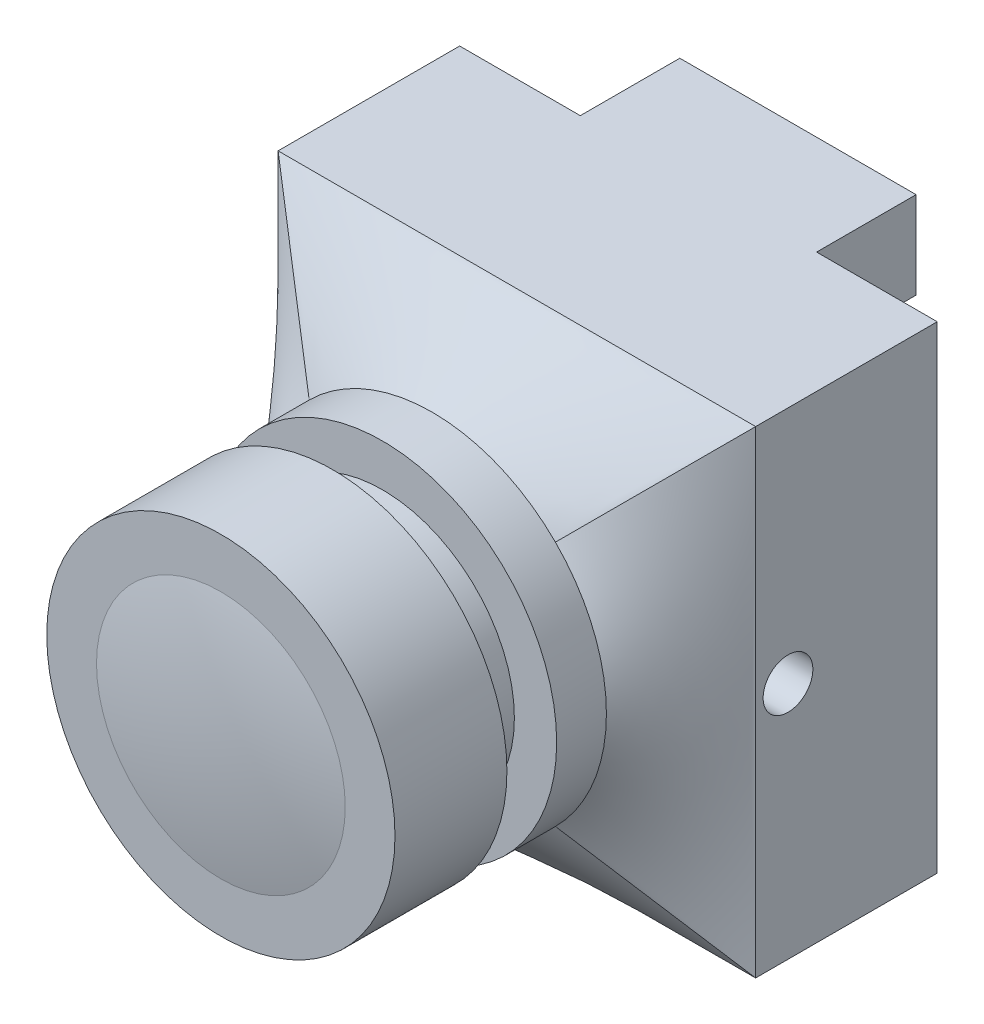
from build123d import *

# Parameters (mm, degrees)
SKETCH1_W           = 19.2
SKETCH1_H           = 19.2
BOSS_EXTRUDE1_DEPTH = 7.3
BOSS_EXTRUDE2_DEPTH = 2
SKETCH4_R           = 5.3
BOSS_EXTRUDE3_DEPTH = 2
SKETCH5_R           = 7
BOSS_EXTRUDE4_DEPTH = 4.5
SKETCH7_R           = 1
CUT_EXTRUDE1_DEPTH  = 19.2
SKETCH8_W           = 9.5
SKETCH8_H           = 3.5
BOSS_EXTRUDE5_DEPTH = 4


with BuildPart() as part:
    # Sketch1 → Boss-Extrude1 (new body)
    with BuildSketch(Plane.XY):
        Rectangle(SKETCH1_W, SKETCH1_H)
    extrude(amount=BOSS_EXTRUDE1_DEPTH)

    # Loft1: read off the stored shape, not the designer's step
    # Loft1: loft between two sections, ruled curve by curve
    loft1_from = [
        Edge.make_bspline([(9.6, -9.6, 7.3), (9.6, -8.8, 7.3), (9.6, -8, 7.3), (9.6, -6.4, 7.3), (9.6, -5.6, 7.3), (9.6, -4, 7.3), (9.6, -3.2, 7.3), (9.6, -1.6, 7.3), (9.6, -0.8, 7.3), (9.6, 0.8, 7.3), (9.6, 1.6, 7.3), (9.6, 3.2, 7.3), (9.6, 4, 7.3), (9.6, 5.6, 7.3), (9.6, 6.4, 7.3), (9.6, 8, 7.3), (9.6, 8.8, 7.3), (9.6, 9.6, 7.3)], [0, 0, 0, 0, 0.125, 0.125, 0.25, 0.25, 0.375, 0.375, 0.5, 0.5, 0.625, 0.625, 0.75, 0.75, 0.875, 0.875, 1, 1, 1, 1], 3),
        Edge.make_bspline([(9.6, 9.6, 7.3), (8.8, 9.6, 7.3), (8, 9.6, 7.3), (6.4, 9.6, 7.3), (5.6, 9.6, 7.3), (4, 9.6, 7.3), (3.2, 9.6, 7.3), (1.6, 9.6, 7.3), (0.8, 9.6, 7.3), (-0.8, 9.6, 7.3), (-1.6, 9.6, 7.3), (-3.2, 9.6, 7.3), (-4, 9.6, 7.3), (-5.6, 9.6, 7.3), (-6.4, 9.6, 7.3), (-8, 9.6, 7.3), (-8.8, 9.6, 7.3), (-9.6, 9.6, 7.3)], [0, 0, 0, 0, 0.125, 0.125, 0.25, 0.25, 0.375, 0.375, 0.5, 0.5, 0.625, 0.625, 0.75, 0.75, 0.875, 0.875, 1, 1, 1, 1], 3),
        Edge.make_bspline([(-9.6, -9.6, 7.3), (-8.8, -9.6, 7.3), (-8, -9.6, 7.3), (-6.4, -9.6, 7.3), (-5.6, -9.6, 7.3), (-4, -9.6, 7.3), (-3.2, -9.6, 7.3), (-1.6, -9.6, 7.3), (-0.8, -9.6, 7.3), (0.8, -9.6, 7.3), (1.6, -9.6, 7.3), (3.2, -9.6, 7.3), (4, -9.6, 7.3), (5.6, -9.6, 7.3), (6.4, -9.6, 7.3), (8, -9.6, 7.3), (8.8, -9.6, 7.3), (9.6, -9.6, 7.3)], [0, 0, 0, 0, 0.125, 0.125, 0.25, 0.25, 0.375, 0.375, 0.5, 0.5, 0.625, 0.625, 0.75, 0.75, 0.875, 0.875, 1, 1, 1, 1], 3),
        Edge.make_bspline([(-9.6, 9.6, 7.3), (-9.6, 8.8, 7.3), (-9.6, 8, 7.3), (-9.6, 6.4, 7.3), (-9.6, 5.6, 7.3), (-9.6, 4, 7.3), (-9.6, 3.2, 7.3), (-9.6, 1.6, 7.3), (-9.6, 0.8, 7.3), (-9.6, -0.8, 7.3), (-9.6, -1.6, 7.3), (-9.6, -3.2, 7.3), (-9.6, -4, 7.3), (-9.6, -5.6, 7.3), (-9.6, -6.4, 7.3), (-9.6, -8, 7.3), (-9.6, -8.8, 7.3), (-9.6, -9.6, 7.3)], [0, 0, 0, 0, 0.125, 0.125, 0.25, 0.25, 0.375, 0.375, 0.5, 0.5, 0.625, 0.625, 0.75, 0.75, 0.875, 0.875, 1, 1, 1, 1], 3),
    ]
    loft1_to = [
        Edge.make_bspline([(4.949747468, -4.949747468, 10.7), (5.241414135, -4.658080802, 10.7), (5.518059607, -4.329578337, 10.7), (6.017509224, -3.603305863, 10.7), (6.24015166, -3.205498765, 10.7), (6.608234632, -2.3549841, 10.7), (6.753494754, -1.902343121, 10.7), (6.949438254, -0.966389521, 10.7), (7, -0.483249156, 10.7), (7, 0.483249156, 10.7), (6.949438254, 0.966389521, 10.7), (6.753494754, 1.902343121, 10.7), (6.608234632, 2.3549841, 10.7), (6.24015166, 3.205498765, 10.7), (6.017509224, 3.603305863, 10.7), (5.518059607, 4.329578337, 10.7), (5.241414135, 4.658080802, 10.7), (4.949747468, 4.949747468, 10.7)], [0, 0, 0, 0, 0.125, 0.125, 0.25, 0.25, 0.375, 0.375, 0.5, 0.5, 0.625, 0.625, 0.75, 0.75, 0.875, 0.875, 1, 1, 1, 1], 3),
        Edge.make_bspline([(4.949747468, 4.949747468, 10.7), (4.658080802, 5.241414135, 10.7), (4.329578337, 5.518059607, 10.7), (3.603305863, 6.017509224, 10.7), (3.205498765, 6.24015166, 10.7), (2.3549841, 6.608234632, 10.7), (1.902343121, 6.753494754, 10.7), (0.966389521, 6.949438254, 10.7), (0.483249156, 7, 10.7), (-0.483249156, 7, 10.7), (-0.966389521, 6.949438254, 10.7), (-1.902343121, 6.753494754, 10.7), (-2.3549841, 6.608234632, 10.7), (-3.205498765, 6.24015166, 10.7), (-3.603305863, 6.017509224, 10.7), (-4.329578337, 5.518059607, 10.7), (-4.658080802, 5.241414135, 10.7), (-4.949747468, 4.949747468, 10.7)], [0, 0, 0, 0, 0.125, 0.125, 0.25, 0.25, 0.375, 0.375, 0.5, 0.5, 0.625, 0.625, 0.75, 0.75, 0.875, 0.875, 1, 1, 1, 1], 3),
        Edge.make_bspline([(-4.949747468, -4.949747468, 10.7), (-4.658080802, -5.241414135, 10.7), (-4.329578337, -5.518059607, 10.7), (-3.603305863, -6.017509224, 10.7), (-3.205498765, -6.24015166, 10.7), (-2.3549841, -6.608234632, 10.7), (-1.902343121, -6.753494754, 10.7), (-0.966389521, -6.949438254, 10.7), (-0.483249156, -7, 10.7), (0.483249156, -7, 10.7), (0.966389521, -6.949438254, 10.7), (1.902343121, -6.753494754, 10.7), (2.3549841, -6.608234632, 10.7), (3.205498765, -6.24015166, 10.7), (3.603305863, -6.017509224, 10.7), (4.329578337, -5.518059607, 10.7), (4.658080802, -5.241414135, 10.7), (4.949747468, -4.949747468, 10.7)], [0, 0, 0, 0, 0.125, 0.125, 0.25, 0.25, 0.375, 0.375, 0.5, 0.5, 0.625, 0.625, 0.75, 0.75, 0.875, 0.875, 1, 1, 1, 1], 3),
        Edge.make_bspline([(-4.949747468, 4.949747468, 10.7), (-5.241414135, 4.658080802, 10.7), (-5.518059607, 4.329578337, 10.7), (-6.017509224, 3.603305863, 10.7), (-6.24015166, 3.205498765, 10.7), (-6.608234632, 2.3549841, 10.7), (-6.753494754, 1.902343121, 10.7), (-6.949438254, 0.966389521, 10.7), (-7, 0.483249156, 10.7), (-7, -0.483249156, 10.7), (-6.949438254, -0.966389521, 10.7), (-6.753494754, -1.902343121, 10.7), (-6.608234632, -2.3549841, 10.7), (-6.24015166, -3.205498765, 10.7), (-6.017509224, -3.603305863, 10.7), (-5.518059607, -4.329578337, 10.7), (-5.241414135, -4.658080802, 10.7), (-4.949747468, -4.949747468, 10.7)], [0, 0, 0, 0, 0.125, 0.125, 0.25, 0.25, 0.375, 0.375, 0.5, 0.5, 0.625, 0.625, 0.75, 0.75, 0.875, 0.875, 1, 1, 1, 1], 3),
    ]
    loft1 = Solid(Shell([*[Face.make_surface_from_curves(loft1_from[k], loft1_to[k]) for k in range(4)], Face(Wire(loft1_from)), Face(Wire(loft1_to))]))
    add(loft1)

    # Sketch3 → Boss-Extrude2 (add)
    with BuildSketch(Plane.XY.offset(10.7)):
        with BuildLine():
            ThreePointArc((-4.949747468, -4.949747468), (0, -7), (4.949747468, -4.949747468))
            ThreePointArc((4.949747468, -4.949747468), (7, 0), (4.949747468, 4.949747468))
            ThreePointArc((4.949747468, 4.949747468), (0, 7), (-4.949747468, 4.949747468))
            ThreePointArc((-4.949747468, 4.949747468), (-7, 0), (-4.949747468, -4.949747468))
        make_face()
    extrude(amount=BOSS_EXTRUDE2_DEPTH)

    # Sketch4 → Boss-Extrude3 (add)
    with BuildSketch(Plane.XY.offset(12.7)):
        Circle(SKETCH4_R)
    extrude(amount=BOSS_EXTRUDE3_DEPTH)

    # Sketch5 → Boss-Extrude4 (add)
    with BuildSketch(Plane.XY.offset(14.7)):
        with Locations(Location((0, 0, 0), (0, 0, 135))):
            Circle(SKETCH5_R)
    extrude(amount=BOSS_EXTRUDE4_DEPTH)

    # Sketch6 → Revolve3 (revolve)
    with BuildSketch(Plane(origin=(0, 0, 0), x_dir=(1, 0, 0), z_dir=(0, 1, 0))):
        with BuildLine():
            Line((0, -19.2), (5, -19.2))
            add(Edge.make_bspline(
                [(0, -19.7), (2.5, -19.7), (5, -19.2)],
                knots=[0.5, 0.5, 0.5, 1, 1, 1], degree=2))
            Line((0, -19.7), (0, -19.2))
        make_face()
    revolve(axis=Axis((0, 0, 19.7), (0, 0, 1)))

    # Sketch7 → Cut-Extrude1 (cut)
    with BuildSketch(Plane(origin=(9.6, 0, 0), x_dir=(0, 0, -1), z_dir=(1, 0, 0))):
        with Locations((-6, 0)):
            Circle(SKETCH7_R)
    extrude(amount=-CUT_EXTRUDE1_DEPTH, mode=Mode.SUBTRACT)

    # Sketch8 → Boss-Extrude5 (add)
    with BuildSketch(Plane(origin=(0, 0, 0), x_dir=(-1, 0, 0), z_dir=(0, 0, -1))):
        with Locations((0, 7.85)):
            Rectangle(SKETCH8_W, SKETCH8_H)
    extrude(amount=BOSS_EXTRUDE5_DEPTH)


solid = part.part
